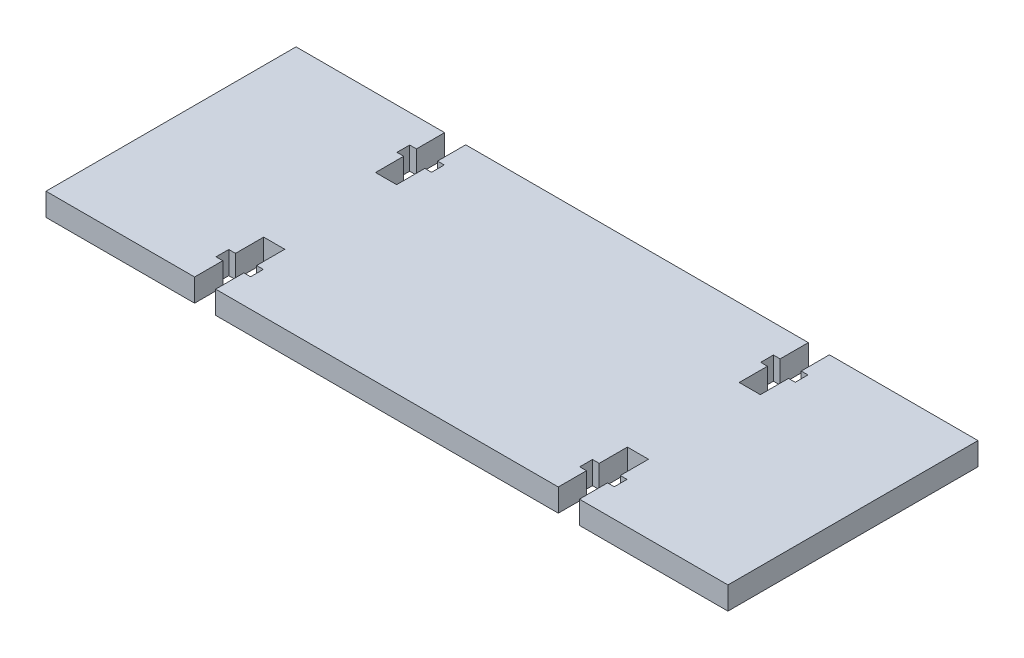
from build123d import *

# Parameters (mm, degrees)
SKETCH1_W           = 95.25
SKETCH1_H           = 34.925
BOSS_EXTRUDE1_DEPTH = 3.175
CUT_EXTRUDE2_DEPTH  = 51.824798635


with BuildPart() as part:
    # Sketch1 → Boss-Extrude1 (new body)
    with BuildSketch(Plane(origin=(0, 0, 0), x_dir=(1, 0, 0), z_dir=(0, 1, 0))):
        Rectangle(SKETCH1_W, SKETCH1_H)
    extrude(amount=BOSS_EXTRUDE1_DEPTH)

    # Sketch3 → Cut-Extrude2 (cut, through all)
    with BuildSketch(Plane(origin=(0, 3.175, 0), x_dir=(1, 0, 0), z_dir=(0, 1, 0))):
        Polygon((-26.8732, 17.4625), (-23.9268, 17.4625), (-23.9268, 13.5255), (-22.987, 13.5255), (-22.987, 11.7475), (-23.9268, 11.7475), (-23.9268, 7.8105), (-26.8732, 7.8105), (-26.8732, 11.7475), (-27.813, 11.7475), (-27.813, 13.5255), (-26.8732, 13.5255), align=None)
        Polygon((23.9268, 17.4625), (26.8732, 17.4625), (26.8732, 13.5255), (27.813, 13.5255), (27.813, 11.7475), (26.8732, 11.7475), (26.8732, 7.8105), (23.9268, 7.8105), (23.9268, 11.7475), (22.987, 11.7475), (22.987, 13.5255), (23.9268, 13.5255), align=None)
        Polygon((26.8732, -11.7475), (26.8732, -7.8105), (23.9268, -7.8105), (23.9268, -11.7475), (22.987, -11.7475), (22.987, -13.5255), (23.9268, -13.5255), (23.9268, -17.4625), (26.8732, -17.4625), (26.8732, -13.5255), (27.813, -13.5255), (27.813, -11.7475), align=None)
        Polygon((-23.9268, -11.7475), (-23.9268, -7.8105), (-26.8732, -7.8105), (-26.8732, -11.7475), (-27.813, -11.7475), (-27.813, -13.5255), (-26.8732, -13.5255), (-26.8732, -17.4625), (-23.9268, -17.4625), (-23.9268, -13.5255), (-22.987, -13.5255), (-22.987, -11.7475), align=None)
    extrude(amount=-CUT_EXTRUDE2_DEPTH, mode=Mode.SUBTRACT)


solid = part.part
